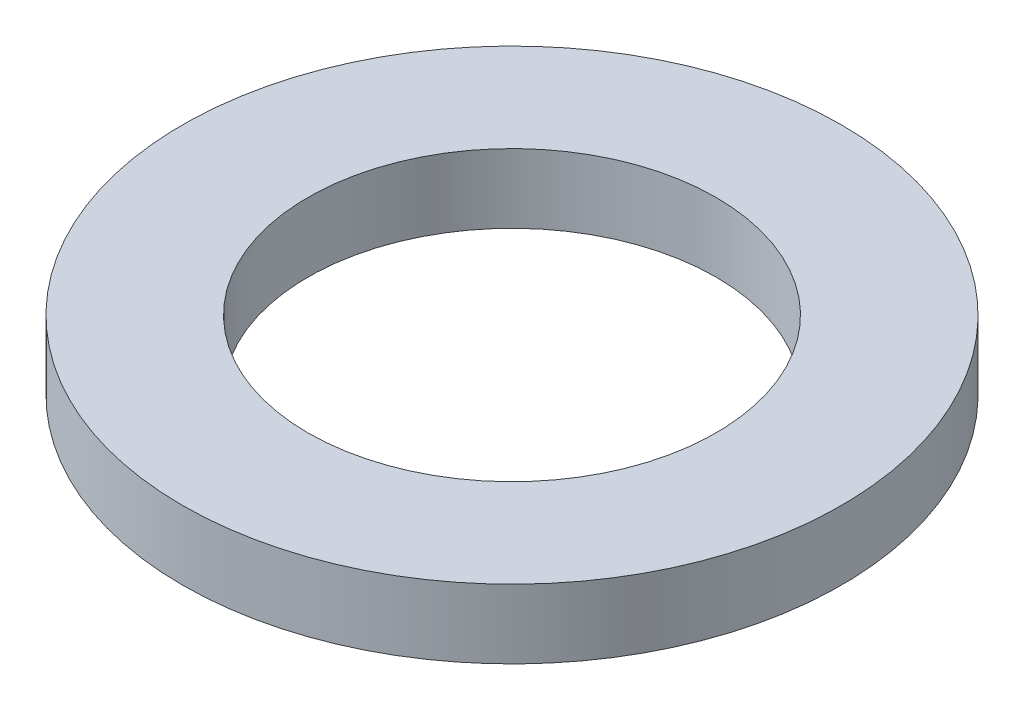
from build123d import *

# Parameters (mm, degrees)
SKETCH1_R           = 52.5
BOSS_EXTRUDE1_DEPTH = 11
SKETCH2_R           = 32.5
CUT_EXTRUDE1_DEPTH  = 76.056645275


with BuildPart() as part:
    # Sketch1 → Boss-Extrude1 (new body)
    with BuildSketch(Plane(origin=(0, 0, 0), x_dir=(1, 0, 0), z_dir=(0, 1, 0))):
        Circle(SKETCH1_R)
    extrude(amount=BOSS_EXTRUDE1_DEPTH)

    # Sketch2 → Cut-Extrude1 (cut, through all)
    with BuildSketch(Plane(origin=(0, 0, 0), x_dir=(1, 0, 0), z_dir=(0, 1, 0))):
        Circle(SKETCH2_R)
    extrude(amount=CUT_EXTRUDE1_DEPTH, mode=Mode.SUBTRACT)


solid = part.part
